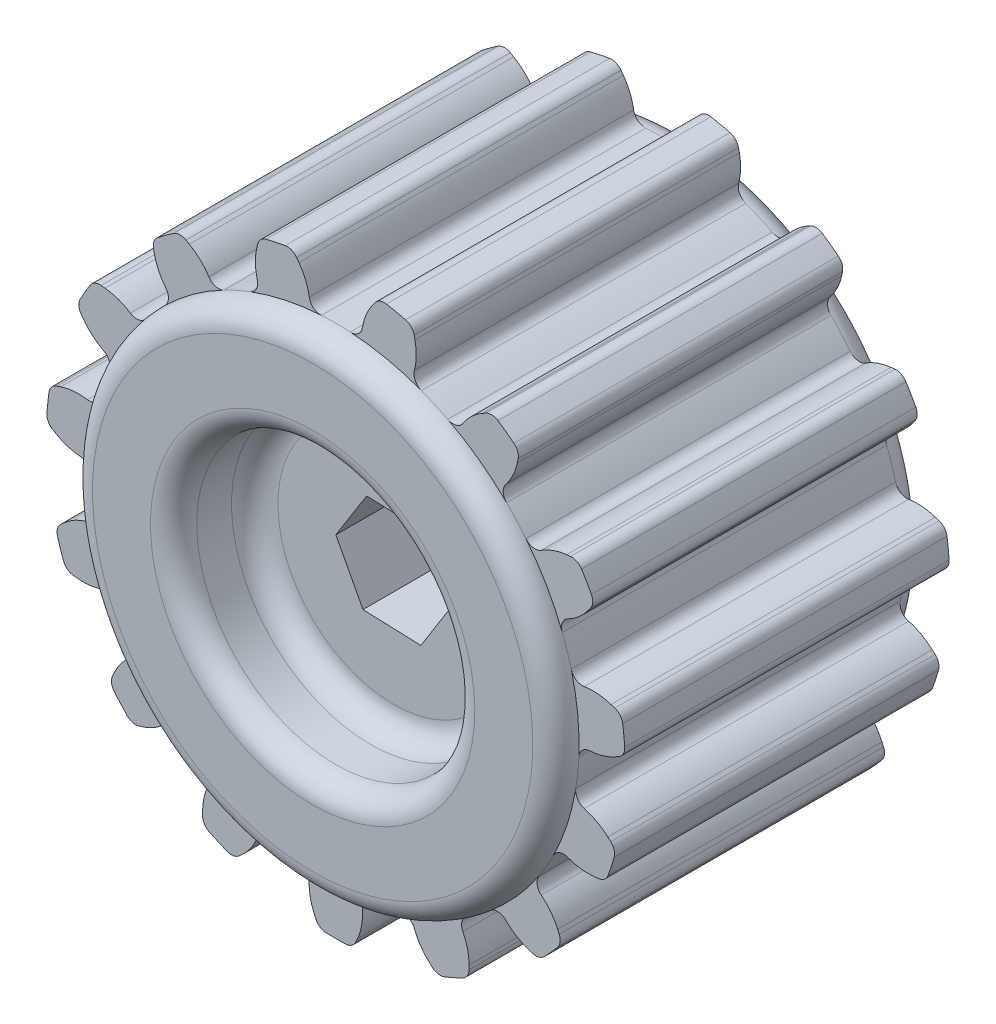
from build123d import *

# Parameters (mm, degrees)
SKETCH2_W          = 4
SKETCH2_H          = 28
REVOLVE2_ANGLE     = 12
FILLET2_R          = 1
CUT_EXTRUDE1_DEPTH = 42.121770441
CHAMFER1_SIZE      = 2
CHAMFER2_SIZE      = 2
FILLET3_START      = -14
FILLET3_DEPTH      = 28
FILLET4_R          = 1
CIRPATTERN1_START  = -14
CIRPATTERN1_DEPTH  = 28


with BuildPart() as part:
    # Sketch1 → Revolve1 (revolve)
    with BuildSketch(Plane(origin=(0, 0, 0), x_dir=(0, 0, -1), z_dir=(1, 0, 0)), mode=Mode.PRIVATE) as revolve1_sk:
        with BuildLine():
            Line((-9, 0), (9, 0))
            Line((9, 0), (9, 10))
            ThreePointArc((9, 10), (9.585786438, 11.414213562), (11, 12))
            Line((11, 12), (14, 12))
            ThreePointArc((14, 12), (15.414213562, 12.585786438), (16, 14))
            Line((16, 14), (16, 19))
            ThreePointArc((16, 19), (15.414213562, 20.414213562), (14, 21))
            Line((14, 21), (-14, 21))
            ThreePointArc((-14, 21), (-15.414213562, 20.414213562), (-16, 19))
            Line((-16, 19), (-16, 14))
            ThreePointArc((-16, 14), (-15.414213562, 12.585786438), (-14, 12))
            Line((-14, 12), (-11, 12))
            ThreePointArc((-11, 12), (-9.585786438, 11.414213562), (-9, 10))
            Line((-9, 10), (-9, 0))
        make_face()
    revolve(revolve1_sk.sketch.rotate(Axis((0, 0, 9), (0, 0, -1)), 180), axis=Axis((0, 0, 9), (0, 0, -1)))

    # Sketch2 → Revolve2 (revolve)
    with BuildSketch(Plane(origin=(0, 0, 0), x_dir=(1, 0, 0), z_dir=(0, 1, 0))):
        with Locations((23, 0)):
            Rectangle(SKETCH2_W, SKETCH2_H)
    revolve(axis=Axis((0, 0, 14), (0, 0, 1)), revolution_arc=REVOLVE2_ANGLE)

    # Fillet2
    # the kernel refuses this fillet: 1 mm, written as the material it adds along each edge
    with BuildSketch(Plane(origin=(21, 0, -14), x_dir=(-0.022733147686346798, -0.9997415686047424, 0), z_dir=(0, 0, 1))) as fillet2_piece_1:
        with BuildLine():
            CenterArc((0.977525351, 0.999741569), FILLET2_R, 181.302625633, 87.394748735)
            Line((-0.022216218, 0.977008421), (0, 0))
            ThreePointArc((0, 0), (0.477396101, 0.005427059), (0.954792203, 0))
        make_face()
    extrude(amount=28)
    with BuildSketch(Plane(origin=(20.541099615, 4.366145507, -14), x_dir=(-0.2300943337759382, 0.9731683295115019, 0), z_dir=(0, 0, 1))) as fillet2_piece_2:
        with BuildLine():
            CenterArc((0.977525351, -0.999741569), FILLET2_R, 91.302625633, 87.394748735)
            Line((-0.022216218, -0.977008421), (0, 0))
            ThreePointArc((0, 0), (0.477396101, -0.005427059), (0.954792203, 0))
        make_face()
    extrude(amount=28)

    # Sketch5 → Cut-Extrude1 (cut, through all)
    with BuildSketch(Plane.XY.offset(9)):
        Polygon((2.657066293, 4.235563565), (-2.3395725, 4.418868692), (-4.996638793, 0.183305127), (-2.657066293, -4.235563565), (2.3395725, -4.418868692), (4.996638793, -0.183305127), align=None)
    extrude(amount=-CUT_EXTRUDE1_DEPTH, mode=Mode.SUBTRACT)

    # Chamfer1
    # the kernel refuses this chamfer: 2, 1.154700538 mm, written as the material it takes off along each edge
    with BuildSketch(Plane(origin=(24.453690018, 5.19779227, 19.174171509), x_dir=(-0.9781476007338057, -0.20791169081775954, 0), z_dir=(0, 0, -1))) as chamfer1_piece_1:
        with BuildLine():
            Line((CHAMFER1_SIZE, 0), (0.025991573, -1.139694297))
            ThreePointArc((0.025991573, -1.139694297), (0.006943466, -0.589173213), (0, 0))
            Line((0, 0), (CHAMFER1_SIZE, 0))
        make_face()
    extrude(amount=38.348343019, mode=Mode.SUBTRACT)

    # Chamfer2
    # the kernel refuses this chamfer: 2, 1.154700538 mm, written as the material it takes off along each edge
    with BuildSketch(Plane(origin=(25, 0, 19.174171509), x_dir=(-1, 0, 0), z_dir=(0, 0, -1))) as chamfer2_piece_1:
        with BuildLine():
            Line((CHAMFER2_SIZE, 0), (0.025991573, 1.139694297))
            ThreePointArc((0.025991573, 1.139694297), (0.006943466, 0.589173213), (0, 0))
            Line((0, 0), (CHAMFER2_SIZE, 0))
        make_face()
    extrude(amount=38.348343019, mode=Mode.SUBTRACT)

    # Fillet3: read off the stored shape, not the designer's step
    # Fillet3 outline → Fillet3 (cut)
    with BuildSketch(Plane.XY.offset(FILLET3_START)):
        with BuildLine():
            add(Edge.make_bspline(
                [(23.753975544, 4.373681061), (22.62030982, 4.742031383), (21.442392931, 4.559297321)],
                knots=[0, 0, 0, 1, 1, 1], degree=2))
            Line((23.753975544, 4.373681061), (22.497394817, 4.781968889))
            Line((22.497394817, 4.781968889), (21.497005094, 4.569329489))
            ThreePointArc((21.497005094, 4.569329489), (21.469768657, 4.563934283), (21.442392931, 4.559297321))
        make_face()
        with BuildLine():
            add(Edge.make_bspline(
                [(21.921756415, -0.001541566), (23.111925541, 0.064620241), (24.14423361, 0.660623583)],
                knots=[0, 0, 0, 1, 1, 1], degree=2))
            ThreePointArc((21.921756415, -0.001541566), (21.949497994, -0.000385466), (21.977260976, 0))
            Line((21.977260976, 0), (23, 0))
            Line((23, 0), (24.14423361, 0.660623583))
        make_face()
    extrude(amount=FILLET3_DEPTH, mode=Mode.SUBTRACT)

    # Fillet4
    fillet4_edges = [part.edges().sort_by_distance(p)[0] for p in [
        (24.974008427, 1.139694297, 0),
        (24.665222192, 4.077599077, 0),
    ]]
    fillet(fillet4_edges, radius=FILLET4_R)

    # CirPattern1: read off the stored shape, not the designer's step
    # CirPattern1 outline → CirPattern1 (add)
    with BuildSketch(Plane.XY.offset(CIRPATTERN1_START)):
        with BuildLine():
            Line((20.260940226, 13.692855843), (19.921400106, 13.657168739))
            add(Edge.make_bspline(
                [(19.921400106, 13.657168739), (18.73592336, 13.532570112), (17.734167376, 12.886532278)],
                knots=[0, 0, 0, 1, 1, 1], degree=2))
            ThreePointArc((17.734167376, 12.886532278), (17.030790405, 12.740038131), (16.410729078, 13.10297566))
            ThreePointArc((16.410729078, 13.10297566), (18.18653348, 10.5), (19.552874326, 7.660620446))
            ThreePointArc((19.552874326, 7.660620446), (19.548591869, 8.379078072), (20.027148008, 8.914973324))
            add(Edge.make_bspline(
                [(20.027148008, 8.914973324), (21.087511175, 9.459500537), (21.788155125, 10.423854202)],
                knots=[0, 0, 0, 1, 1, 1], degree=2))
            Line((21.788155125, 10.423854202), (21.988831124, 10.700061019))
            ThreePointArc((21.988831124, 10.700061019), (22.17741186, 11.218573131), (22.062306385, 11.758173199))
            ThreePointArc((22.062306385, 11.758173199), (21.650635095, 12.5), (21.214029885, 13.227431196))
            ThreePointArc((21.214029885, 13.227431196), (20.804275255, 13.596915495), (20.260940226, 13.692855843))
        make_face()
        with BuildLine():
            ThreePointArc((20.718329659, -3.427946348), (19.972186842, -6.489356882), (18.776377098, -9.404661774))
            ThreePointArc((18.776377098, -9.404661774), (19.307429642, -8.920737302), (20.025893985, -8.917789905))
            add(Edge.make_bspline(
                [(20.025893985, -8.917789905), (21.140078015, -9.341433482), (22.325554761, -9.216834855)],
                knots=[0, 0, 0, 1, 1, 1], degree=2))
            Line((22.325554761, -9.216834855), (22.665094882, -9.18114775))
            ThreePointArc((22.665094882, -9.18114775), (23.176609617, -8.974338225), (23.500590019, -8.527735265))
            ThreePointArc((23.500590019, -8.527735265), (23.776412907, -7.725424859), (24.024853728, -6.91421748))
            ThreePointArc((24.024853728, -6.91421748), (24.02525471, -6.362477194), (23.732990185, -5.894503955))
            Line((23.732990185, -5.894503955), (23.479272811, -5.666055806))
            add(Edge.make_bspline(
                [(23.479272811, -5.666055806), (22.593439213, -4.868447651), (21.443033951, -4.556281562)],
                knots=[0, 0, 0, 1, 1, 1], degree=2))
            ThreePointArc((21.443033951, -4.556281562), (20.863516524, -4.131594323), (20.718329659, -3.427946348))
        make_face()
        with BuildLine():
            ThreePointArc((17.532864559, -11.558488671), (15.606041335, -14.051742734), (13.327853449, -16.228626634))
            ThreePointArc((13.327853449, -16.228626634), (14.009823904, -16.00253816), (14.667372555, -16.292071354))
            add(Edge.make_bspline(
                [(14.667372555, -16.292071354), (15.512918949, -17.132268491), (16.646584673, -17.500618814)],
                knots=[0, 0, 0, 1, 1, 1], degree=2))
            Line((16.646584673, -17.500618814), (16.971285261, -17.60612043))
            ThreePointArc((16.971285261, -17.60612043), (17.522694236, -17.625242314), (18.000314849, -17.34902491))
            ThreePointArc((18.000314849, -17.34902491), (18.578620637, -16.728265159), (19.135530386, -16.088240328))
            ThreePointArc((19.135530386, -16.088240328), (19.360309693, -15.584363589), (19.283654628, -15.037974071))
            Line((19.283654628, -15.037974071), (19.144790508, -14.72608015))
            add(Edge.make_bspline(
                [(19.144790508, -14.72608015), (18.659957711, -13.637127858), (17.735979596, -12.884037972)],
                knots=[0, 0, 0, 1, 1, 1], degree=2))
            ThreePointArc((17.735979596, -12.884037972), (17.379299945, -12.260355901), (17.532864559, -11.558488671))
        make_face()
        with BuildLine():
            ThreePointArc((11.315807897, -17.690463296), (8.541469505, -19.18445461), (5.57482286, -20.246514517))
            ThreePointArc((5.57482286, -20.246514517), (6.289792338, -20.317354792), (6.772729162, -20.849305657))
            add(Edge.make_bspline(
                [(6.772729162, -20.849305657), (7.203435266, -21.960778637), (8.089268865, -22.758386792)],
                knots=[0, 0, 0, 1, 1, 1], degree=2))
            Line((8.089268865, -22.758386792), (8.342986239, -22.986834941))
            ThreePointArc((8.342986239, -22.986834941), (8.838945833, -23.228581887), (9.387621714, -23.170510537))
            ThreePointArc((9.387621714, -23.170510537), (10.168416077, -22.838636441), (10.9375, -22.480460266))
            ThreePointArc((10.9375, -22.480460266), (11.347791248, -22.111571941), (11.5, -21.581241855))
            Line((11.5, -21.581241855), (11.5, -21.239831453))
            add(Edge.make_bspline(
                [(11.5, -21.239831453), (11.5, -20.047824769), (10.962213243, -18.984027168)],
                knots=[0, 0, 0, 1, 1, 1], degree=2))
            ThreePointArc((10.962213243, -18.984027168), (10.89004452, -18.269190561), (11.315807897, -17.690463296))
        make_face()
        with BuildLine():
            ThreePointArc((3.142145248, -20.763596105), (0, -21), (-3.142145248, -20.763596106))
            ThreePointArc((-3.142145248, -20.763596106), (-2.517801464, -21.119116202), (-2.292980632, -21.801505602))
            add(Edge.make_bspline(
                [(-2.292980632, -21.801505602), (-2.351587815, -22.992070649), (-1.866755018, -24.08102294)],
                knots=[0, 0, 0, 1, 1, 1], degree=2))
            Line((-1.866755018, -24.08102294), (-1.727890897, -24.392916862))
            ThreePointArc((-1.727890897, -24.392916862), (-1.373136604, -24.815488626), (-0.8482765, -24.985604395))
            ThreePointArc((-0.8482765, -24.985604395), (0, -25), (0.8482765, -24.985604395))
            ThreePointArc((0.8482765, -24.985604395), (1.373136604, -24.815488626), (1.727890897, -24.392916862))
            Line((1.727890897, -24.392916862), (1.866755018, -24.08102294))
            add(Edge.make_bspline(
                [(1.866755018, -24.08102294), (2.351587815, -22.992070649), (2.292980632, -21.801505602)],
                knots=[0, 0, 0, 1, 1, 1], degree=2))
            ThreePointArc((2.292980632, -21.801505602), (2.517801464, -21.119116202), (3.142145248, -20.763596105))
        make_face()
        with BuildLine():
            ThreePointArc((-5.57482286, -20.246514517), (-8.541469505, -19.18445461), (-11.315807897, -17.690463296))
            ThreePointArc((-11.315807897, -17.690463296), (-10.89004452, -18.269190561), (-10.962213243, -18.984027168))
            add(Edge.make_bspline(
                [(-10.962213243, -18.984027168), (-11.5, -20.047824769), (-11.5, -21.239831453)],
                knots=[0, 0, 0, 1, 1, 1], degree=2))
            Line((-11.5, -21.239831453), (-11.5, -21.581241855))
            ThreePointArc((-11.5, -21.581241855), (-11.347791248, -22.111571941), (-10.9375, -22.480460266))
            ThreePointArc((-10.9375, -22.480460266), (-10.168416077, -22.838636441), (-9.387621714, -23.170510537))
            ThreePointArc((-9.387621714, -23.170510537), (-8.838945833, -23.228581887), (-8.342986239, -22.986834941))
            Line((-8.342986239, -22.986834941), (-8.089268865, -22.758386792))
            add(Edge.make_bspline(
                [(-8.089268865, -22.758386792), (-7.203435266, -21.960778637), (-6.772729162, -20.849305657)],
                knots=[0, 0, 0, 1, 1, 1], degree=2))
            ThreePointArc((-6.772729162, -20.849305657), (-6.289792338, -20.317354792), (-5.57482286, -20.246514517))
        make_face()
        with BuildLine():
            ThreePointArc((-13.327853449, -16.228626634), (-15.606041335, -14.051742734), (-17.532864559, -11.558488671))
            ThreePointArc((-17.532864559, -11.558488671), (-17.379299945, -12.260355901), (-17.735979596, -12.884037972))
            add(Edge.make_bspline(
                [(-17.735979596, -12.884037972), (-18.659957711, -13.637127858), (-19.144790508, -14.72608015)],
                knots=[0, 0, 0, 1, 1, 1], degree=2))
            Line((-19.144790508, -14.72608015), (-19.283654628, -15.037974071))
            ThreePointArc((-19.283654628, -15.037974071), (-19.360309693, -15.584363589), (-19.135530386, -16.088240328))
            ThreePointArc((-19.135530386, -16.088240328), (-18.578620637, -16.728265159), (-18.000314849, -17.34902491))
            ThreePointArc((-18.000314849, -17.34902491), (-17.522694236, -17.625242314), (-16.971285261, -17.60612043))
            Line((-16.971285261, -17.60612043), (-16.646584673, -17.500618814))
            add(Edge.make_bspline(
                [(-16.646584673, -17.500618814), (-15.512918949, -17.132268491), (-14.667372555, -16.292071354)],
                knots=[0, 0, 0, 1, 1, 1], degree=2))
            ThreePointArc((-14.667372555, -16.292071354), (-14.009823904, -16.00253816), (-13.327853449, -16.228626634))
        make_face()
        with BuildLine():
            ThreePointArc((-18.776377098, -9.404661774), (-19.972186842, -6.489356882), (-20.718329659, -3.427946348))
            ThreePointArc((-20.718329659, -3.427946348), (-20.863516524, -4.131594323), (-21.443033951, -4.556281562))
            add(Edge.make_bspline(
                [(-21.443033951, -4.556281562), (-22.593439213, -4.868447651), (-23.479272811, -5.666055806)],
                knots=[0, 0, 0, 1, 1, 1], degree=2))
            Line((-23.479272811, -5.666055806), (-23.732990185, -5.894503955))
            ThreePointArc((-23.732990185, -5.894503955), (-24.02525471, -6.362477194), (-24.024853728, -6.91421748))
            ThreePointArc((-24.024853728, -6.91421748), (-23.776412907, -7.725424859), (-23.500590019, -8.527735265))
            ThreePointArc((-23.500590019, -8.527735265), (-23.176609617, -8.974338225), (-22.665094882, -9.18114775))
            Line((-22.665094882, -9.18114775), (-22.325554761, -9.216834855))
            add(Edge.make_bspline(
                [(-22.325554761, -9.216834855), (-21.140078015, -9.341433482), (-20.025893985, -8.917789905)],
                knots=[0, 0, 0, 1, 1, 1], degree=2))
            ThreePointArc((-20.025893985, -8.917789905), (-19.307429642, -8.920737302), (-18.776377098, -9.404661774))
        make_face()
        with BuildLine():
            ThreePointArc((-20.978294568, -0.954545455), (-20.884959803, 2.195097728), (-20.32140734, 5.29531904))
            ThreePointArc((-20.32140734, 5.29531904), (-20.740241556, 4.711557447), (-21.442392931, 4.559297321))
            add(Edge.make_bspline(
                [(-21.442392931, 4.559297321), (-22.62030982, 4.742031383), (-23.753975544, 4.373681061)],
                knots=[0, 0, 0, 1, 1, 1], degree=2))
            Line((-23.753975544, 4.373681061), (-24.078676131, 4.268179445))
            ThreePointArc((-24.078676131, 4.268179445), (-24.536014924, 3.95953931), (-24.760061601, 3.455336384))
            ThreePointArc((-24.760061601, 3.455336384), (-24.863047384, 2.613211582), (-24.937399679, 1.768077279))
            ThreePointArc((-24.937399679, 1.768077279), (-24.823078642, 1.228310473), (-24.439903692, 0.831328784))
            Line((-24.439903692, 0.831328784), (-24.14423361, 0.660623583))
            add(Edge.make_bspline(
                [(-24.14423361, 0.660623583), (-23.111925541, 0.064620241), (-21.921756415, -0.001541566)],
                knots=[0, 0, 0, 1, 1, 1], degree=2))
            ThreePointArc((-21.921756415, -0.001541566), (-21.266605392, -0.296459922), (-20.978294568, -0.954545455))
        make_face()
        with BuildLine():
            ThreePointArc((-19.552874326, 7.660620446), (-18.18653348, 10.5), (-16.410729078, 13.10297566))
            ThreePointArc((-16.410729078, 13.10297566), (-17.030790405, 12.740038131), (-17.734167376, 12.886532278))
            add(Edge.make_bspline(
                [(-17.734167376, 12.886532278), (-18.73592336, 13.532570112), (-19.921400106, 13.657168739)],
                knots=[0, 0, 0, 1, 1, 1], degree=2))
            Line((-19.921400106, 13.657168739), (-20.260940226, 13.692855843))
            ThreePointArc((-20.260940226, 13.692855843), (-20.804275255, 13.596915495), (-21.214029885, 13.227431196))
            ThreePointArc((-21.214029885, 13.227431196), (-21.650635095, 12.5), (-22.062306385, 11.758173199))
            ThreePointArc((-22.062306385, 11.758173199), (-22.17741186, 11.218573131), (-21.988831124, 10.700061019))
            Line((-21.988831124, 10.700061019), (-21.788155125, 10.423854202))
            add(Edge.make_bspline(
                [(-21.788155125, 10.423854202), (-21.087511175, 9.459500537), (-20.027148008, 8.914973324)],
                knots=[0, 0, 0, 1, 1, 1], degree=2))
            ThreePointArc((-20.027148008, 8.914973324), (-19.548591869, 8.379078072), (-19.552874326, 7.660620446))
        make_face()
        with BuildLine():
            ThreePointArc((-14.74658448, 14.951195477), (-12.343490298, 16.989356883), (-9.662486671, 18.645008752))
            ThreePointArc((-9.662486671, 18.645008752), (-10.376560872, 18.565650483), (-10.959543172, 18.985568734))
            add(Edge.make_bspline(
                [(-10.959543172, 18.985568734), (-11.611925541, 19.983204528), (-12.64423361, 20.57920787)],
                knots=[0, 0, 0, 1, 1, 1], degree=2))
            Line((-12.64423361, 20.57920787), (-12.939903692, 20.749913071))
            ThreePointArc((-12.939903692, 20.749913071), (-13.475287395, 20.883261468), (-13.999899679, 20.712382987))
            ThreePointArc((-13.999899679, 20.712382987), (-14.694631307, 20.225424859), (-15.372439887, 19.715174154))
            ThreePointArc((-15.372439887, 19.715174154), (-15.697069092, 19.269042577), (-15.735689892, 18.718655497))
            Line((-15.735689892, 18.718655497), (-15.664706679, 18.384705731))
            add(Edge.make_bspline(
                [(-15.664706679, 18.384705731), (-15.416874553, 17.218747254), (-14.669663769, 16.290008336)],
                knots=[0, 0, 0, 1, 1, 1], degree=2))
            ThreePointArc((-14.669663769, 16.290008336), (-14.450449218, 15.605797345), (-14.74658448, 14.951195477))
        make_face()
        with BuildLine():
            ThreePointArc((-7.390476209, 19.656572983), (-4.366145507, 20.541099616), (-1.243512538, 20.963150445))
            ThreePointArc((-1.243512538, 20.963150445), (-1.928129697, 21.181093203), (-2.289914389, 21.801827877))
            add(Edge.make_bspline(
                [(-2.289914389, 21.801827877), (-2.480120305, 22.97856134), (-3.180764254, 23.942915004)],
                knots=[0, 0, 0, 1, 1, 1], degree=2))
            Line((-3.180764254, 23.942915004), (-3.381440253, 24.219121822))
            ThreePointArc((-3.381440253, 24.219121822), (-3.816299924, 24.558701814), (-4.365059633, 24.615975593))
            ThreePointArc((-4.365059633, 24.615975593), (-5.197792271, 24.453690018), (-6.024538879, 24.26324239))
            ThreePointArc((-6.024538879, 24.26324239), (-6.502560474, 23.987719508), (-6.761704924, 23.500624386))
            Line((-6.761704924, 23.500624386), (-6.832688138, 23.16667462))
            add(Edge.make_bspline(
                [(-6.832688138, 23.16667462), (-7.080520263, 22.000716143), (-6.775661395, 20.848352917)],
                knots=[0, 0, 0, 1, 1, 1], degree=2))
            ThreePointArc((-6.775661395, 20.848352917), (-6.85369262, 20.134132484), (-7.390476209, 19.656572983))
        make_face()
        with BuildLine():
            ThreePointArc((1.243512538, 20.963150445), (4.366145507, 20.541099616), (7.390476209, 19.656572983))
            ThreePointArc((7.390476209, 19.656572983), (6.85369262, 20.134132484), (6.775661395, 20.848352917))
            add(Edge.make_bspline(
                [(6.775661395, 20.848352917), (7.080520263, 22.000716143), (6.832688138, 23.16667462)],
                knots=[0, 0, 0, 1, 1, 1], degree=2))
            Line((6.832688138, 23.16667462), (6.761704924, 23.500624386))
            ThreePointArc((6.761704924, 23.500624386), (6.502560474, 23.987719508), (6.024538879, 24.26324239))
            ThreePointArc((6.024538879, 24.26324239), (5.197792271, 24.453690018), (4.365059633, 24.615975593))
            ThreePointArc((4.365059633, 24.615975593), (3.816299924, 24.558701814), (3.381440253, 24.219121822))
            Line((3.381440253, 24.219121822), (3.180764254, 23.942915004))
            add(Edge.make_bspline(
                [(3.180764254, 23.942915004), (2.480120305, 22.97856134), (2.289914389, 21.801827877)],
                knots=[0, 0, 0, 1, 1, 1], degree=2))
            ThreePointArc((2.289914389, 21.801827877), (1.928129697, 21.181093203), (1.243512538, 20.963150445))
        make_face()
        with BuildLine():
            ThreePointArc((9.662486671, 18.645008752), (12.343490298, 16.989356882), (14.74658448, 14.951195477))
            ThreePointArc((14.74658448, 14.951195477), (14.450449218, 15.605797345), (14.669663769, 16.290008336))
            add(Edge.make_bspline(
                [(14.669663769, 16.290008336), (15.416874553, 17.218747254), (15.664706679, 18.384705731)],
                knots=[0, 0, 0, 1, 1, 1], degree=2))
            Line((15.664706679, 18.384705731), (15.735689892, 18.718655497))
            ThreePointArc((15.735689892, 18.718655497), (15.697069092, 19.269042577), (15.372439887, 19.715174154))
            ThreePointArc((15.372439887, 19.715174154), (14.694631307, 20.225424859), (13.999899679, 20.712382987))
            ThreePointArc((13.999899679, 20.712382987), (13.475287395, 20.883261468), (12.939903692, 20.749913071))
            Line((12.939903692, 20.749913071), (12.64423361, 20.57920787))
            add(Edge.make_bspline(
                [(12.64423361, 20.57920787), (11.611925541, 19.983204528), (10.959543172, 18.985568734)],
                knots=[0, 0, 0, 1, 1, 1], degree=2))
            ThreePointArc((10.959543172, 18.985568734), (10.376560872, 18.565650483), (9.662486671, 18.645008752))
        make_face()
    extrude(amount=CIRPATTERN1_DEPTH)


solid = part.part
